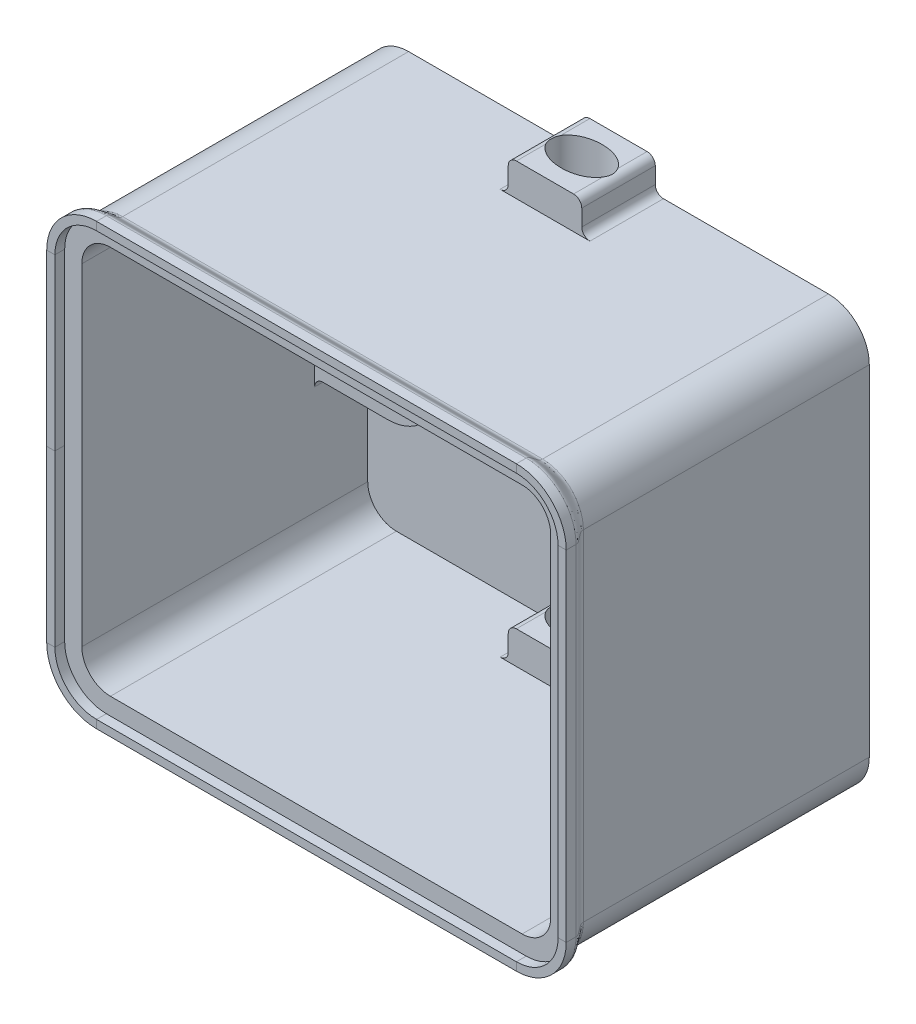
from build123d import *

# Parameters (mm, degrees)
THICKEN2_START       = -2
THICKEN2_OUTLINE_W   = 61.4
THICKEN2_OUTLINE_H   = 51.6
THICKEN2_OUTLINE_W_2 = 57.4
THICKEN2_OUTLINE_H_2 = 47.6
THICKEN2_DEPTH       = 37
THICKEN2_2_OUTLINE_W = 57.4
THICKEN2_2_OUTLINE_H = 47.6
THICKEN2_2_DEPTH     = 2
FILLET1_R            = 5
FILLET2_R            = 3.5
SKETCH3_R            = 2
BOSS_EXTRUDE1_DEPTH  = 6.5
SKETCH5_W            = 9
SKETCH5_H            = 10
BOSS_EXTRUDE2_DEPTH  = 9
CUT_EXTRUDE1_REACH   = 77.628
SKETCH6_RX           = 3.75
SKETCH6_RY           = 2.5
CUT_EXTRUDE2_REACH   = 77.628
SKETCH7_RX           = 3.75
SKETCH7_RY           = 2.5
FILLET3_R            = 1
SKETCH12_R           = 3.7
CUT_EXTRUDE3_DEPTH   = 3
SKETCH13_R           = 2
BOSS_EXTRUDE3_DEPTH  = 0.4


# Read off the part's stored shape, not the designer's step: Thicken2
with BuildPart() as part:
    # Thicken2 outline → Thicken2 (new body)
    with BuildSketch(Plane.XY.offset(THICKEN2_START)):
        Rectangle(THICKEN2_OUTLINE_W, THICKEN2_OUTLINE_H)
        Rectangle(THICKEN2_OUTLINE_W_2, THICKEN2_OUTLINE_H_2, mode=Mode.SUBTRACT)
    extrude(amount=THICKEN2_DEPTH)

    # Thicken2 2 outline → Thicken2 2 (add)
    with BuildSketch(Plane.XY.offset(THICKEN2_START)):
        Rectangle(THICKEN2_2_OUTLINE_W, THICKEN2_2_OUTLINE_H)
    extrude(amount=THICKEN2_2_DEPTH)

    # Fillet1
    fillet1_edges = [part.edges().sort_by_distance(p)[0] for p in [
        (30.7, 25.8, 16.5),
        (-30.7, 25.8, 16.5),
        (30.7, -25.8, 16.5),
        (-30.7, -25.8, 16.5),
    ]]
    fillet(fillet1_edges, radius=FILLET1_R)

    # Fillet2
    fillet2_edges = [part.edges().sort_by_distance(p)[0] for p in [
        (28.7, 23.8, 17.5),
        (-28.7, 23.8, 17.5),
        (28.7, -23.8, 17.5),
        (-28.7, -23.8, 17.5),
    ]]
    fillet(fillet2_edges, radius=FILLET2_R)

    # Sketch3 → Boss-Extrude1 (add)
    # profile 1 of 2: a face of its own
    with BuildSketch(Plane.XY):
        with BuildLine():
            Line((-19.75, 6), (-28.7, 6))
            Line((-28.7, 6), (-28.7, -6))
            Line((-28.7, -6), (-19.75, -6))
            ThreePointArc((-19.75, -6), (-13.75, 0), (-19.75, 6))
        make_face()
        with Locations(Location((-19.75, 0, 0), (0, 0, 180))):
            Circle(SKETCH3_R, mode=Mode.SUBTRACT)
    # profile 2 of 2: a face of its own
    with BuildSketch(Plane.XY):
        with BuildLine():
            Line((19.75, 6), (28.7, 6))
            Line((28.7, 6), (28.7, -6))
            Line((28.7, -6), (19.75, -6))
            ThreePointArc((19.75, -6), (13.75, 0), (19.75, 6))
        make_face()
        with Locations(Location((19.75, 0, 0), (0, 0, 180))):
            Circle(SKETCH3_R, mode=Mode.SUBTRACT)
    extrude(amount=BOSS_EXTRUDE1_DEPTH)

    # Sketch5 → Boss-Extrude2 (add)
    with BuildSketch(Plane(origin=(0, 0, -2), x_dir=(-1, 0, 0), z_dir=(0, 0, -1))):
        with Locations((0, 24.8)):
            Rectangle(SKETCH5_W, SKETCH5_H)
        with Locations((0, -24.8)):
            Rectangle(SKETCH5_W, SKETCH5_H)
    extrude(amount=-BOSS_EXTRUDE2_DEPTH)

    # Sketch6 → Cut-Extrude1 (cut, up to next)
    with BuildSketch(Plane.XZ.offset(29.8), mode=Mode.PRIVATE) as cut_extrude1_sk1:
        with Locations(Location((0, 2.5), (0, 0, -180))):
            Ellipse(SKETCH6_RX, SKETCH6_RY)
    cut_extrude1_tool1 = extrude(cut_extrude1_sk1.sketch, amount=-CUT_EXTRUDE1_REACH, mode=Mode.PRIVATE) & part.part
    add(cut_extrude1_tool1.solids().sort_by_distance((0, -29.8, 2.5))[0], mode=Mode.SUBTRACT)

    # Sketch7 → Cut-Extrude2 (cut, up to next)
    with BuildSketch(Plane(origin=(0, 29.8, 0), x_dir=(1, 0, 0), z_dir=(0, 1, 0)), mode=Mode.PRIVATE) as cut_extrude2_sk1:
        with Locations(Location((0, -2.5), (0, 0, -180))):
            Ellipse(SKETCH7_RX, SKETCH7_RY)
    cut_extrude2_tool1 = extrude(cut_extrude2_sk1.sketch, amount=-CUT_EXTRUDE2_REACH, mode=Mode.PRIVATE) & part.part
    add(cut_extrude2_tool1.solids().sort_by_distance((0, 29.8, 2.5))[0], mode=Mode.SUBTRACT)

    # Fillet3
    # the kernel refuses this fillet: 1 mm, written as the material it adds along each edge
    with BuildSketch(Plane(origin=(-28.7, -6, 0), x_dir=(0, -1, 0), z_dir=(0, 0, 1)), Plane(origin=(28.7, 6, 0), x_dir=(0, 1, 0), z_dir=(0, 0, 1))) as fillet3_piece_1:
        with BuildLine():
            CenterArc((FILLET3_R, FILLET3_R), FILLET3_R, 180, 90)
            Line((0, FILLET3_R), (-FILLET3_R * 0.02, FILLET3_R))
            Line((-FILLET3_R * 0.02, FILLET3_R), (-FILLET3_R * 0.02, -FILLET3_R * 0.02))
            Line((-FILLET3_R * 0.02, -FILLET3_R * 0.02), (FILLET3_R, -FILLET3_R * 0.02))
            Line((FILLET3_R, -FILLET3_R * 0.02), (FILLET3_R, 0))
        make_face()
    extrude(amount=6.5)
    with BuildSketch(Plane(origin=(-28.7, 6, 0), x_dir=(0, 1, 0), z_dir=(0, 0, 1)), Plane(origin=(28.7, -6, 0), x_dir=(0, -1, 0), z_dir=(0, 0, 1))) as fillet3_piece_2:
        with BuildLine():
            CenterArc((FILLET3_R, -FILLET3_R), FILLET3_R, 90, 90)
            Line((0, -FILLET3_R), (-FILLET3_R * 0.02, -FILLET3_R))
            Line((-FILLET3_R * 0.02, -FILLET3_R), (-FILLET3_R * 0.02, FILLET3_R * 0.02))
            Line((-FILLET3_R * 0.02, FILLET3_R * 0.02), (FILLET3_R, FILLET3_R * 0.02))
            Line((FILLET3_R, FILLET3_R * 0.02), (FILLET3_R, 0))
        make_face()
    extrude(amount=6.5)
    with BuildSketch(Plane(origin=(4.5, 23.8, 7), x_dir=(1, 0, 0), z_dir=(0, 0, -1)), Plane(origin=(-4.5, 23.8, 0), x_dir=(-1, 0, 0), z_dir=(0, 0, 1)), Plane(origin=(-4.5, -23.8, 7), x_dir=(-1, 0, 0), z_dir=(0, 0, -1)), Plane(origin=(4.5, -23.8, 0), x_dir=(1, 0, 0), z_dir=(0, 0, 1))) as fillet3_piece_3:
        with BuildLine():
            CenterArc((FILLET3_R, FILLET3_R), FILLET3_R, 180, 90)
            Line((0, FILLET3_R), (-FILLET3_R * 0.02, FILLET3_R))
            Line((-FILLET3_R * 0.02, FILLET3_R), (-FILLET3_R * 0.02, -FILLET3_R * 0.02))
            Line((-FILLET3_R * 0.02, -FILLET3_R * 0.02), (FILLET3_R, -FILLET3_R * 0.02))
            Line((FILLET3_R, -FILLET3_R * 0.02), (FILLET3_R, 0))
        make_face()
    extrude(amount=7)
    with BuildSketch(Plane(origin=(4.5, 25.8, -2), x_dir=(1, 0, 0), z_dir=(0, 0, 1)), Plane(origin=(-4.5, 25.8, 7), x_dir=(-1, 0, 0), z_dir=(0, 0, -1)), Plane(origin=(-4.5, -25.8, -2), x_dir=(-1, 0, 0), z_dir=(0, 0, 1)), Plane(origin=(4.5, -25.8, 7), x_dir=(1, 0, 0), z_dir=(0, 0, -1))) as fillet3_piece_4:
        with BuildLine():
            CenterArc((FILLET3_R, FILLET3_R), FILLET3_R, 180, 90)
            Line((0, FILLET3_R), (-FILLET3_R * 0.02, FILLET3_R))
            Line((-FILLET3_R * 0.02, FILLET3_R), (-FILLET3_R * 0.02, -FILLET3_R * 0.02))
            Line((-FILLET3_R * 0.02, -FILLET3_R * 0.02), (FILLET3_R, -FILLET3_R * 0.02))
            Line((FILLET3_R, -FILLET3_R * 0.02), (FILLET3_R, 0))
        make_face()
    extrude(amount=9)
    # the kernel refuses this fillet: 1 mm, written as the material it takes off along each edge
    with BuildSketch(Plane(origin=(4.5, 19.8, 0), x_dir=(-1, 0, 0), z_dir=(0, 0, 1))) as fillet3_2_piece_1:
        with BuildLine():
            CenterArc((FILLET3_R, -FILLET3_R), FILLET3_R, 90, 90)
            Line((0, -FILLET3_R), (-FILLET3_R * 0.02, -FILLET3_R))
            Line((-FILLET3_R * 0.02, -FILLET3_R), (-FILLET3_R * 0.02, FILLET3_R * 0.02))
            Line((-FILLET3_R * 0.02, FILLET3_R * 0.02), (FILLET3_R, FILLET3_R * 0.02))
            Line((FILLET3_R, FILLET3_R * 0.02), (FILLET3_R, 0))
        make_face()
    extrude(amount=7, mode=Mode.SUBTRACT)
    with BuildSketch(Plane(origin=(4.5, 29.8, -2), x_dir=(0, -1, 0), z_dir=(0, 0, 1)), Plane(origin=(-4.5, 29.8, -2), x_dir=(1, 0, 0), z_dir=(0, 0, 1)), Plane(origin=(4.5, -29.8, -2), x_dir=(-1, 0, 0), z_dir=(0, 0, 1))) as fillet3_2_piece_2:
        with BuildLine():
            CenterArc((FILLET3_R, -FILLET3_R), FILLET3_R, 90, 90)
            Line((0, -FILLET3_R), (-FILLET3_R * 0.02, -FILLET3_R))
            Line((-FILLET3_R * 0.02, -FILLET3_R), (-FILLET3_R * 0.02, FILLET3_R * 0.02))
            Line((-FILLET3_R * 0.02, FILLET3_R * 0.02), (FILLET3_R, FILLET3_R * 0.02))
            Line((FILLET3_R, FILLET3_R * 0.02), (FILLET3_R, 0))
        make_face()
    extrude(amount=9, mode=Mode.SUBTRACT)
    with BuildSketch(Plane(origin=(-4.5, 19.8, 0), x_dir=(1, 0, 0), z_dir=(0, 0, 1)), Plane(origin=(-4.5, -19.8, 0), x_dir=(0, -1, 0), z_dir=(0, 0, 1)), Plane(origin=(4.5, -19.8, 0), x_dir=(-1, 0, 0), z_dir=(0, 0, 1))) as fillet3_2_piece_3:
        with BuildLine():
            CenterArc((FILLET3_R, FILLET3_R), FILLET3_R, 180, 90)
            Line((0, FILLET3_R), (-FILLET3_R * 0.02, FILLET3_R))
            Line((-FILLET3_R * 0.02, FILLET3_R), (-FILLET3_R * 0.02, -FILLET3_R * 0.02))
            Line((-FILLET3_R * 0.02, -FILLET3_R * 0.02), (FILLET3_R, -FILLET3_R * 0.02))
            Line((FILLET3_R, -FILLET3_R * 0.02), (FILLET3_R, 0))
        make_face()
    extrude(amount=7, mode=Mode.SUBTRACT)
    with BuildSketch(Plane(origin=(-4.5, -29.8, -2), x_dir=(1, 0, 0), z_dir=(0, 0, 1))) as fillet3_2_piece_4:
        with BuildLine():
            CenterArc((FILLET3_R, FILLET3_R), FILLET3_R, 180, 90)
            Line((0, FILLET3_R), (-FILLET3_R * 0.02, FILLET3_R))
            Line((-FILLET3_R * 0.02, FILLET3_R), (-FILLET3_R * 0.02, -FILLET3_R * 0.02))
            Line((-FILLET3_R * 0.02, -FILLET3_R * 0.02), (FILLET3_R, -FILLET3_R * 0.02))
            Line((FILLET3_R, -FILLET3_R * 0.02), (FILLET3_R, 0))
        make_face()
    extrude(amount=9, mode=Mode.SUBTRACT)

    # Sweep1: sweep along a path in Sketch8
    with BuildLine(Plane.XY.offset(35)) as sweep1_path:
        Line((-25.7, -25.8), (25.7, -25.8))
        ThreePointArc((25.7, -25.8), (29.235533906, -24.335533906), (30.7, -20.8))
        Line((30.7, -20.8), (30.7, 20.8))
        ThreePointArc((30.7, 20.8), (29.235533906, 24.335533906), (25.7, 25.8))
        Line((25.7, 25.8), (-25.7, 25.8))
        ThreePointArc((-25.7, 25.8), (-29.235533906, 24.335533906), (-30.7, 20.8))
        Line((-30.7, 20.8), (-30.7, -20.8))
        ThreePointArc((-30.7, -20.8), (-29.235533906, -24.335533906), (-25.7, -25.8))
    # Sketch9 → Sweep1 (sweep)
    with BuildSketch(Plane(origin=(0, 0, 0), x_dir=(1, 0, 0), z_dir=(0, 1, 0))):
        with BuildLine():
            Line((-30.7, -33), (-30.7, -35))
            Line((-30.7, -35), (-30.8, -35))
            Line((-30.8, -35), (-30.8, -36.2))
            Line((-30.8, -36.2), (-31.8, -36.2))
            Line((-31.8, -36.2), (-31.8, -35))
            add(Edge.make_bspline(
                [(-30.7, -33), (-30.7, -33.305387566), (-31.031112474, -33.742156164), (-31.479428985, -34.339114671), (-31.8, -34.756758509), (-31.8, -35)],
                knots=[0, 0, 0, 0, 0.354712016, 0.699163656, 1, 1, 1, 1], degree=3))
        make_face()
    sweep(path=sweep1_path.line)

    # Sketch12 → Cut-Extrude3 (cut)
    with BuildSketch(Plane(origin=(0, 0, -2), x_dir=(-1, 0, 0), z_dir=(0, 0, -1))):
        with Locations((19.75, 0)):
            Circle(SKETCH12_R)
        with Locations((-19.75, 0)):
            Circle(SKETCH12_R)
    extrude(amount=-CUT_EXTRUDE3_DEPTH, mode=Mode.SUBTRACT)

    # Sketch13 → Boss-Extrude3 (add)
    with BuildSketch(Plane(origin=(0, 0, 1), x_dir=(-1, 0, 0), z_dir=(0, 0, -1))):
        with Locations((-19.75, 0)):
            Circle(SKETCH13_R)
        with Locations((19.75, 0)):
            Circle(SKETCH13_R)
    extrude(amount=-BOSS_EXTRUDE3_DEPTH)


solid = part.part
